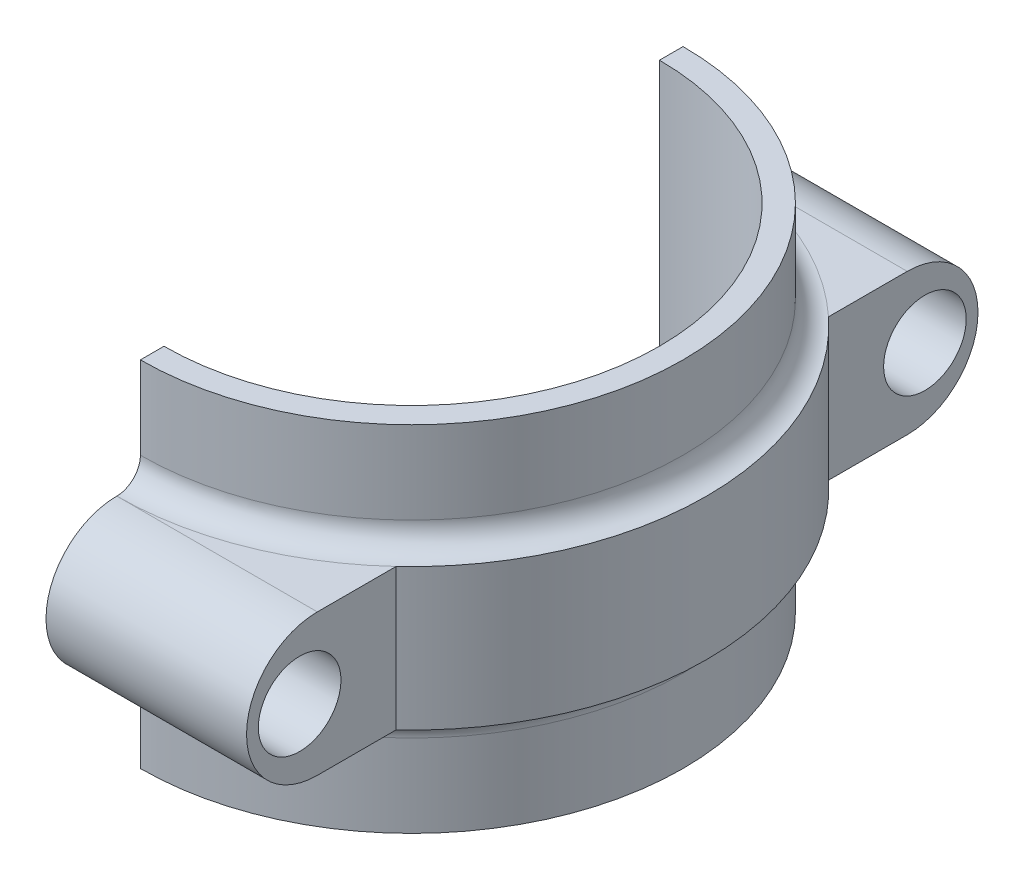
from build123d import *

# Parameters (mm, degrees)
BOSS_EXTRUDE1_DEPTH = 6
BOSS_EXTRUDE2_DEPTH = 15
FILLET1_RADIUS      = 6
FILLET1_LENGTH      = 17
FILLET2_RADIUS      = 6
FILLET2_LENGTH      = 17
FILLET3_ANGLE       = 180
SKETCH2_R           = 3.5
CUT_EXTRUDE1_DEPTH  = 43.555845662


with BuildPart() as part:
    # Sketch1 → Boss-Extrude1 (new, symmetric)
    with BuildSketch(Plane(origin=(0, 0, 0), x_dir=(1, 0, 0), z_dir=(0, 1, 0))):
        with BuildLine():
            Line((25, 0), (23, 0))
            ThreePointArc((23, 0), (16.263455967, -16.263455967), (0, -23))
            Line((0, -23), (0, -31))
            Line((0, -31), (17, -31))
            Line((17, -31), (17, -18.33030278))
            ThreePointArc((17, -18.33030278), (22.912878475, -10), (25, 0))
        make_face()
        with BuildLine():
            Line((0, 31), (0, 23))
            ThreePointArc((0, 23), (16.263455967, 16.263455967), (23, 0))
            Line((23, 0), (25, 0))
            ThreePointArc((25, 0), (22.912878475, 10), (17, 18.33030278))
            Line((17, 18.33030278), (17, 31))
            Line((17, 31), (0, 31))
        make_face()
    extrude(amount=BOSS_EXTRUDE1_DEPTH, both=True)

    # Sketch1<4> → Boss-Extrude2 (add, symmetric)
    with BuildSketch(Plane(origin=(0, 0, 0), x_dir=(1, 0, 0), z_dir=(0, 1, 0))):
        with BuildLine():
            Line((0, 23), (0, 21))
            ThreePointArc((0, 21), (14.849242405, 14.849242405), (21, 0))
            Line((21, 0), (23, 0))
            ThreePointArc((23, 0), (16.263455967, 16.263455967), (0, 23))
        make_face()
        with BuildLine():
            Line((23, 0), (21, 0))
            ThreePointArc((21, 0), (14.849242405, -14.849242405), (0, -21))
            Line((0, -21), (0, -23))
            ThreePointArc((0, -23), (16.263455967, -16.263455967), (23, 0))
        make_face()
    extrude(amount=BOSS_EXTRUDE2_DEPTH, both=True)

    # Fillet1: full round fillet: the end face becomes a half cylinder, R = half its width
    fillet1_face = Plane((8.5, 0, 31), x_dir=(1, 0, 0), z_dir=(0, 0, 1))  # on the end face: x along it, z out of the body
    fillet1_slab = fillet1_face.offset(-FILLET1_RADIUS / 2) * Box(FILLET1_LENGTH, 2 * FILLET1_RADIUS, FILLET1_RADIUS, mode=Mode.PRIVATE)  # the body's end, R deep
    fillet1_round = Plane((8.5, 0, 25), x_dir=(0, 0, 1), z_dir=(1, 0, 0)) * Cylinder(FILLET1_RADIUS, FILLET1_LENGTH, mode=Mode.PRIVATE)  # its axis R under the face
    add(fillet1_slab - fillet1_round, mode=Mode.SUBTRACT)

    # Fillet2: full round fillet: the end face becomes a half cylinder, R = half its width
    fillet2_face = Plane((8.5, 0, -31), x_dir=(-1, 0, 0), z_dir=(0, 0, -1))  # on the end face: x along it, z out of the body
    fillet2_slab = fillet2_face.offset(-FILLET2_RADIUS / 2) * Box(FILLET2_LENGTH, 2 * FILLET2_RADIUS, FILLET2_RADIUS, mode=Mode.PRIVATE)  # the body's end, R deep
    fillet2_round = Plane((8.5, 0, -25), x_dir=(0, 0, -1), z_dir=(-1, 0, 0)) * Cylinder(FILLET2_RADIUS, FILLET2_LENGTH, mode=Mode.PRIVATE)  # its axis R under the face
    add(fillet2_slab - fillet2_round, mode=Mode.SUBTRACT)

    # Fillet3: read off the stored shape, not the designer's step
    # Fillet3 outline → Fillet3 (revolve)
    with BuildSketch(Plane.ZY):
        with BuildLine():
            ThreePointArc((23, -8), (23.585786438, -6.585786438), (25, -6))
            Line((25, -6), (23, -6))
            Line((23, -6), (23, -8))
        make_face()
        with BuildLine():
            Line((23, 6), (25, 6))
            ThreePointArc((25, 6), (23.585786438, 6.585786438), (23, 8))
            Line((23, 8), (23, 6))
        make_face()
    revolve(axis=Axis((0, 0, 0), (0, 1, 0)), revolution_arc=FILLET3_ANGLE)

    # Sketch2 → Cut-Extrude1 (cut, through all)
    with BuildSketch(Plane.ZY):
        with Locations((-26.5, 0)):
            Circle(SKETCH2_R)
        with Locations((26.5, 0)):
            Circle(SKETCH2_R)
    extrude(amount=-CUT_EXTRUDE1_DEPTH, mode=Mode.SUBTRACT)


solid = part.part
